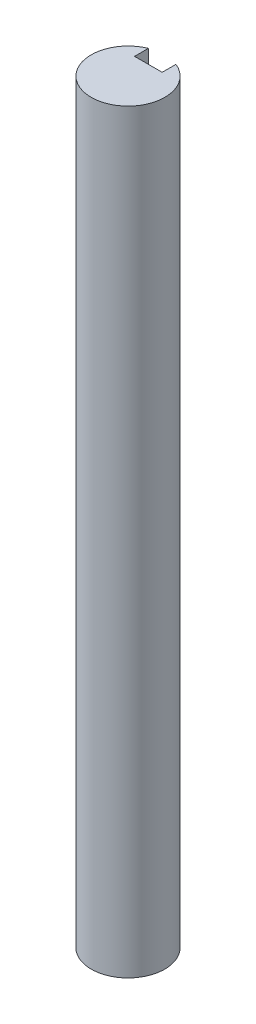
from build123d import *

# Parameters (mm, degrees)
BOSS_EXTRUDE1_DEPTH = 65.0875


with BuildPart() as part:
    # Sketch1 → Boss-Extrude1 (new body)
    with BuildSketch(Plane(origin=(0, 0, 0), x_dir=(1, 0, 0), z_dir=(0, 1, 0))):
        with BuildLine():
            Line((-1.190625, 2.943303775), (-1.190625, 1.752678775))
            Line((-1.190625, 1.752678775), (1.190625, 1.752678775))
            Line((1.190625, 1.752678775), (1.190625, 2.943303775))
            ThreePointArc((1.190625, 2.943303775), (0, -3.175), (-1.190625, 2.943303775))
        make_face()
    extrude(amount=BOSS_EXTRUDE1_DEPTH)


solid = part.part
